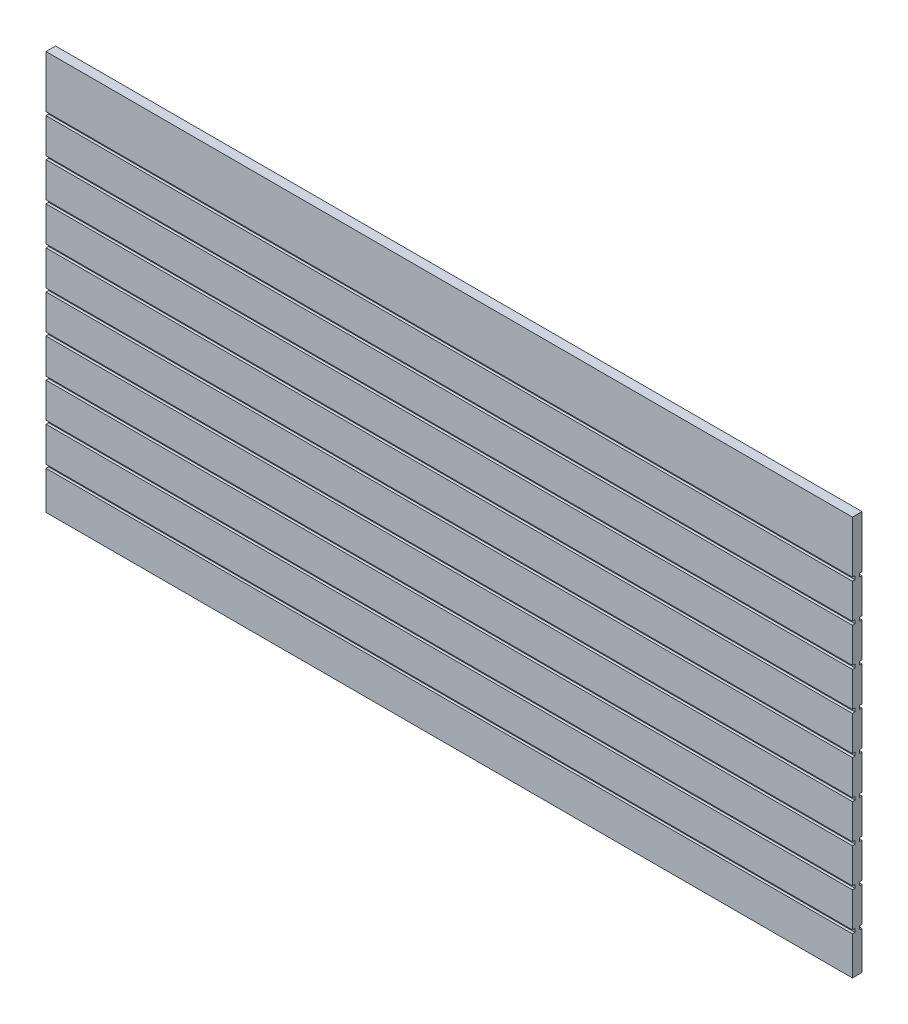
from build123d import *

# Parameters (mm, degrees)
BOSS_EXTRUDE1_DEPTH      = 8.7376
BOSS_EXTRUDE1_DEPTH_BACK = 8.7376
SKETCH1_W                = 1475.316666666
SKETCH1_H                = 730.25
SKETCH2_W                = 1475.316666666
SKETCH2_H                = 6.35
CUT_EXTRUDE1_DEPTH       = 4.7625


with BuildPart() as part:
    # Sketch1 → Boss-Extrude1 (new, two sides: drawn at the far end of the back side and taken through both)
    with BuildSketch(Plane.XY.offset(-BOSS_EXTRUDE1_DEPTH_BACK)):
        Rectangle(SKETCH1_W, SKETCH1_H)
    extrude(amount=BOSS_EXTRUDE1_DEPTH + BOSS_EXTRUDE1_DEPTH_BACK)

    # Sketch2 → Cut-Extrude1 (cut)
    with BuildSketch(Plane.XY.offset(8.7376)):
        with Locations((0, -292.1)):
            Rectangle(SKETCH2_W, SKETCH2_H)
        with Locations((0, -222.25)):
            Rectangle(SKETCH2_W, SKETCH2_H)
        with Locations((0, -152.4)):
            Rectangle(SKETCH2_W, SKETCH2_H)
        with Locations((0, -82.55)):
            Rectangle(SKETCH2_W, SKETCH2_H)
        with Locations((0, -12.7)):
            Rectangle(SKETCH2_W, SKETCH2_H)
        with Locations((0, 57.15)):
            Rectangle(SKETCH2_W, SKETCH2_H)
        with Locations((0, 127)):
            Rectangle(SKETCH2_W, SKETCH2_H)
        with Locations((0, 196.85)):
            Rectangle(SKETCH2_W, SKETCH2_H)
        with Locations((0, 266.7)):
            Rectangle(SKETCH2_W, SKETCH2_H)
    cut_extrude1 = extrude(amount=-CUT_EXTRUDE1_DEPTH, mode=Mode.SUBTRACT)

    # Mirror1: Cut-Extrude1 across plane
    add(cut_extrude1.mirror(Plane.XY), mode=Mode.SUBTRACT)


solid = part.part
